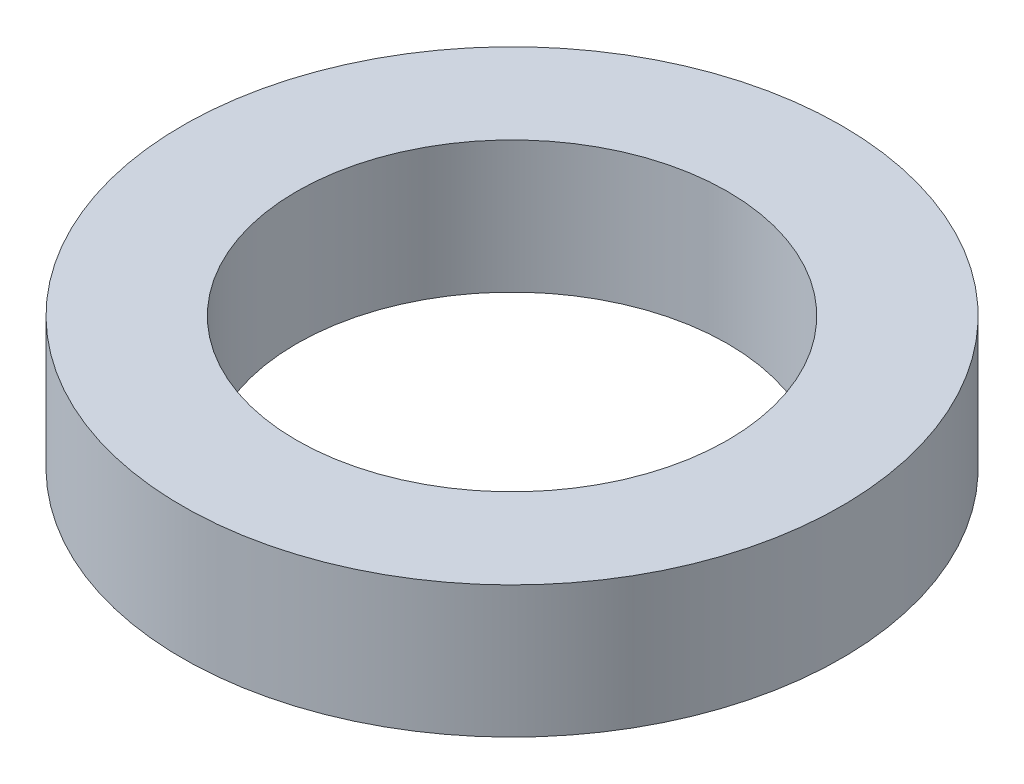
from build123d import *

# Parameters (mm, degrees)
SKETCH1_R           = 65
BOSS_EXTRUDE1_DEPTH = 26
SKETCH2_R           = 42.5
CUT_EXTRUDE1_DEPTH  = 96.530099969


with BuildPart() as part:
    # Sketch1 → Boss-Extrude1 (new body)
    with BuildSketch(Plane(origin=(0, 0, 0), x_dir=(1, 0, 0), z_dir=(0, 1, 0))):
        Circle(SKETCH1_R)
    extrude(amount=BOSS_EXTRUDE1_DEPTH)

    # Sketch2 → Cut-Extrude1 (cut, through all)
    with BuildSketch(Plane(origin=(0, 0, 0), x_dir=(1, 0, 0), z_dir=(0, 1, 0))):
        Circle(SKETCH2_R)
    extrude(amount=CUT_EXTRUDE1_DEPTH, mode=Mode.SUBTRACT)


solid = part.part
